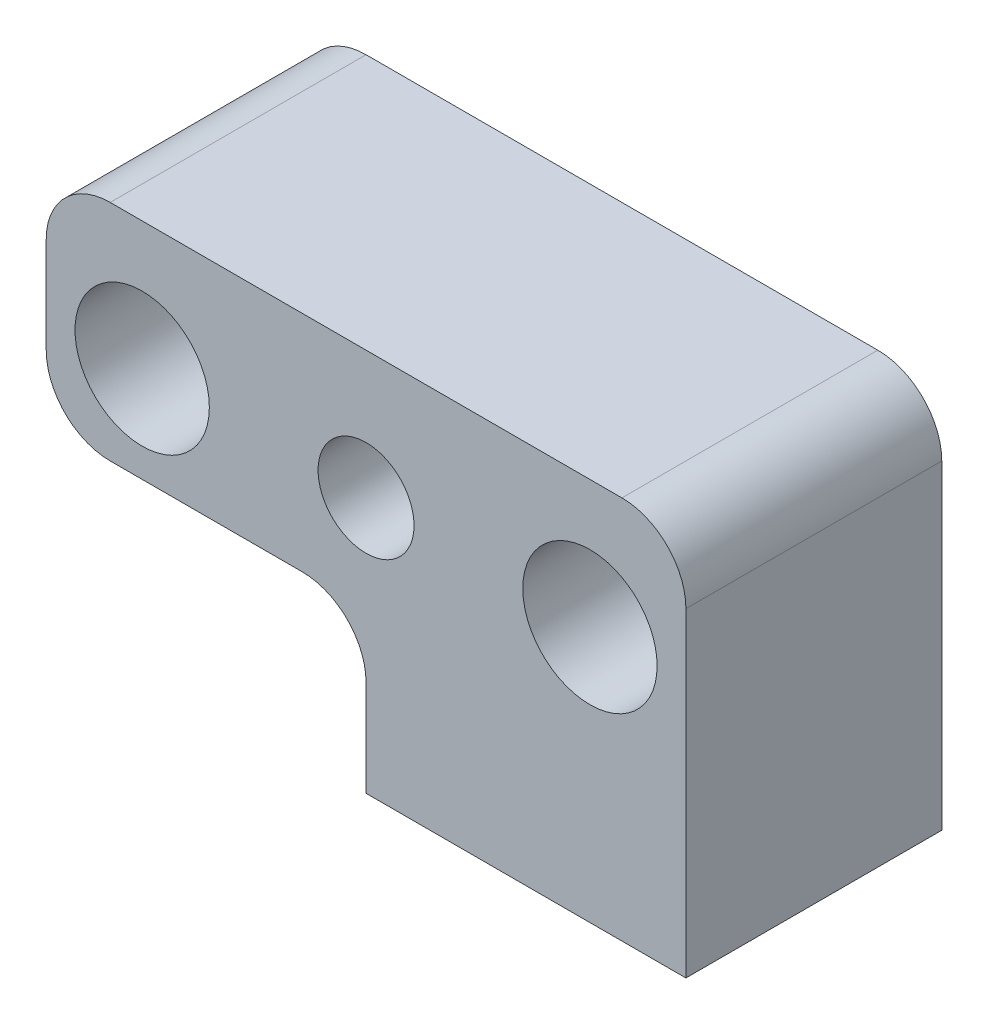
from build123d import *

# Parameters (mm, degrees)
SKETCH1_W           = 100
SKETCH1_H           = 80
BOSS_EXTRUDE1_DEPTH = 40
CUT_EXTRUDE1_REACH  = 77.498
SKETCH2_R           = 7.5
SKETCH2_R_2         = 10.5
CUT_EXTRUDE2_REACH  = 77.498
SKETCH3_W           = 100
SKETCH3_H           = 20
SKETCH4_R           = 3
CUT_EXTRUDE3_DEPTH  = 25
CUT_EXTRUDE4_REACH  = 77.498
SKETCH5_W           = 50
SKETCH5_H           = 25
FILLET1_R           = 10
FILLET2_R           = 10
FILLET3_R           = 10
FILLET4_R           = 10


with BuildPart() as part:
    # Sketch1 → Boss-Extrude1 (new body)
    with BuildSketch(Plane.XY):
        Rectangle(SKETCH1_W, SKETCH1_H)
    extrude(amount=BOSS_EXTRUDE1_DEPTH)

    # Sketch2 → Cut-Extrude1 (cut, up to next)
    with BuildSketch(Plane.XY.offset(40), mode=Mode.PRIVATE) as cut_extrude1_sk1:
        Circle(SKETCH2_R)
    cut_extrude1_tool1 = extrude(cut_extrude1_sk1.sketch, amount=-CUT_EXTRUDE1_REACH, mode=Mode.PRIVATE) & part.part
    # Sketch2 → Cut-Extrude1 (cut, up to next)
    with BuildSketch(Plane.XY.offset(40), mode=Mode.PRIVATE) as cut_extrude1_sk2:
        with Locations((-35, 0)):
            Circle(SKETCH2_R_2)
    cut_extrude1_tool2 = extrude(cut_extrude1_sk2.sketch, amount=-CUT_EXTRUDE1_REACH, mode=Mode.PRIVATE) & part.part
    # Sketch2 → Cut-Extrude1 (cut, up to next)
    with BuildSketch(Plane.XY.offset(40), mode=Mode.PRIVATE) as cut_extrude1_sk3:
        with Locations((35, 0)):
            Circle(SKETCH2_R_2)
    cut_extrude1_tool3 = extrude(cut_extrude1_sk3.sketch, amount=-CUT_EXTRUDE1_REACH, mode=Mode.PRIVATE) & part.part
    add(cut_extrude1_tool1.solids().sort_by_distance((0, 0, 40))[0], mode=Mode.SUBTRACT)
    add(cut_extrude1_tool2.solids().sort_by_distance((-35, 0, 40))[0], mode=Mode.SUBTRACT)
    add(cut_extrude1_tool3.solids().sort_by_distance((35, 0, 40))[0], mode=Mode.SUBTRACT)

    # Sketch3 → Cut-Extrude2 (cut, up to next)
    with BuildSketch(Plane.XY.offset(40), mode=Mode.PRIVATE) as cut_extrude2_sk1:
        with Locations((0, 30)):
            Rectangle(SKETCH3_W, SKETCH3_H)
    cut_extrude2_tool1 = extrude(cut_extrude2_sk1.sketch, amount=-CUT_EXTRUDE2_REACH, mode=Mode.PRIVATE) & part.part
    add(cut_extrude2_tool1.solids().sort_by_distance((0, 30, 40))[0], mode=Mode.SUBTRACT)

    # Sketch4 → Cut-Extrude3 (cut)
    with BuildSketch(Plane.XZ.offset(40)):
        with Locations((16, 20)):
            Circle(SKETCH4_R)
        with Locations((36, 20)):
            Circle(SKETCH4_R)
    extrude(amount=-CUT_EXTRUDE3_DEPTH, mode=Mode.SUBTRACT)

    # Sketch5 → Cut-Extrude4 (cut, up to next)
    with BuildSketch(Plane(origin=(0, 0, 0), x_dir=(-1, 0, 0), z_dir=(0, 0, -1)), mode=Mode.PRIVATE) as cut_extrude4_sk1:
        with Locations((25, -27.5)):
            Rectangle(SKETCH5_W, SKETCH5_H)
    cut_extrude4_tool1 = extrude(cut_extrude4_sk1.sketch, amount=-CUT_EXTRUDE4_REACH, mode=Mode.PRIVATE) & part.part
    add(cut_extrude4_tool1.solids().sort_by_distance((-25, -27.5, 0))[0], mode=Mode.SUBTRACT)

    # Fillet1
    fillet1_edges = [part.edges().sort_by_distance(p)[0] for p in [
        (0, -15, 20),
    ]]
    fillet(fillet1_edges, radius=FILLET1_R)

    # Fillet2
    fillet2_edges = [part.edges().sort_by_distance(p)[0] for p in [
        (-50, -15, 20),
    ]]
    fillet(fillet2_edges, radius=FILLET2_R)

    # Fillet3
    fillet3_edges = [part.edges().sort_by_distance(p)[0] for p in [
        (-50, 20, 20),
    ]]
    fillet(fillet3_edges, radius=FILLET3_R)

    # Fillet4
    fillet4_edges = [part.edges().sort_by_distance(p)[0] for p in [
        (50, 20, 20),
    ]]
    fillet(fillet4_edges, radius=FILLET4_R)


solid = part.part
